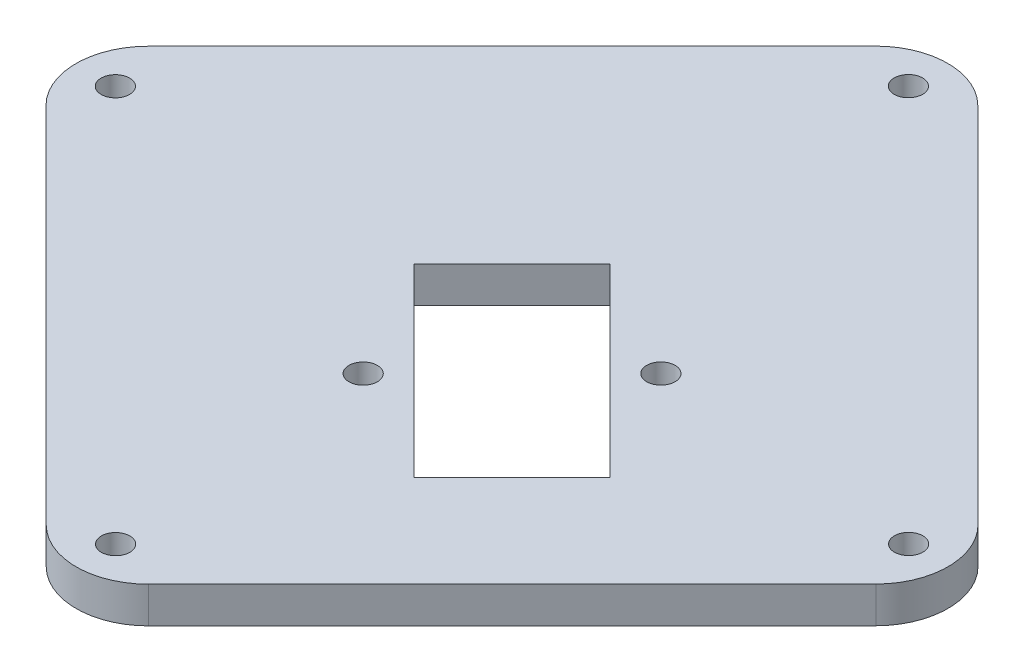
from build123d import *

# Parameters (mm, degrees)
SKETCH1_R           = 1.25
BOSS_EXTRUDE1_DEPTH = 3.175
FILLET1_R           = 6.35


with BuildPart() as part:
    # Sketch1 → Boss-Extrude1 (new body)
    with BuildSketch(Plane(origin=(0, 0, 0), x_dir=(1, 0, 0), z_dir=(0, 1, 0))):
        Polygon((15.147658291, 44.238817403), (-25.76324473, 3.302114568), (15.173458104, -37.608788453), (56.084361126, 3.327914382), align=None)
        with Locations((26.142043997, 5.411582921)):
            Circle(SKETCH1_R, mode=Mode.SUBTRACT)
        with Locations((13.070913285, -7.667790893)):
            Circle(SKETCH1_R, mode=Mode.SUBTRACT)
        with Locations((-19.669398793, 3.304035457)):
            Circle(SKETCH1_R, mode=Mode.SUBTRACT)
        with Locations((15.149579179, 38.144971466)):
            Circle(SKETCH1_R, mode=Mode.SUBTRACT)
        with Locations((49.990509247, 3.325999432)):
            Circle(SKETCH1_R, mode=Mode.SUBTRACT)
        with Locations((15.171537216, -31.514942515)):
            Circle(SKETCH1_R, mode=Mode.SUBTRACT)
        Polygon((23.203491037, -13.339058415), (6.949055942, 2.905132538), (15.565263232, 11.526773503), (31.819698327, -4.71741745), align=None, mode=Mode.SUBTRACT)
    extrude(amount=BOSS_EXTRUDE1_DEPTH)

    # Fillet1
    fillet1_edges = [part.edges().sort_by_distance(p)[0] for p in [
        (-25.76324473, 1.5875, -3.302114568),
        (15.147658291, 1.5875, -44.238817403),
        (15.173458104, 1.5875, 37.608788453),
        (56.084361126, 1.5875, -3.327914382),
    ]]
    fillet(fillet1_edges, radius=FILLET1_R)


solid = part.part
